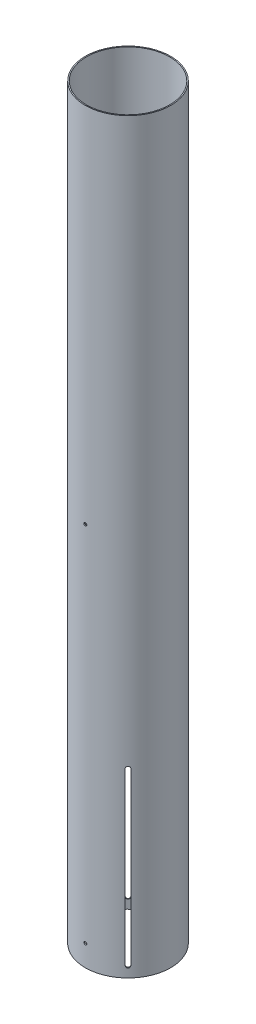
from build123d import *

# Parameters (mm, degrees)
SKETCH1_R           = 50.8
SKETCH1_R_2         = 49.53
BOSS_EXTRUDE1_DEPTH = 889
CUT_EXTRUDE1_DEPTH  = 152.4
CIRPATTERN1_COUNT   = 4
SKETCH3_R           = 1.7653
CUT_EXTRUDE2_DEPTH  = 11.684


with BuildPart() as part:
    # Sketch1 → Boss-Extrude1 (new body)
    with BuildSketch(Plane(origin=(0, 0, 0), x_dir=(1, 0, 0), z_dir=(0, 1, 0))):
        Circle(SKETCH1_R)
        Circle(SKETCH1_R_2, mode=Mode.SUBTRACT)
    extrude(amount=BOSS_EXTRUDE1_DEPTH)

    # Sketch2 → Cut-Extrude1 (cut)
    with BuildSketch(Plane(origin=(1.021732913, 1243.355570529, -179.1581259), x_dir=(0, 1, 0), z_dir=(0.7071067811865634, 0, -0.7071067811865316))):
        with BuildLine():
            Line((-1230.655570529, 128.342701458), (-1027.455570529, 128.342701458))
            ThreePointArc((-1027.455570529, 128.342701458), (-1025.074320529, 125.961451458), (-1027.455570529, 123.580201458))
            Line((-1027.455570529, 123.580201458), (-1230.655570529, 123.580201458))
            ThreePointArc((-1230.655570529, 123.580201458), (-1233.036820529, 125.961451458), (-1230.655570529, 128.342701458))
        make_face()
    cut_extrude1 = extrude(amount=-CUT_EXTRUDE1_DEPTH, mode=Mode.SUBTRACT)

    # CirPattern1: Cut-Extrude1 ×4 about axis
    cirpattern1_axis = Axis((0, 889, 0), (0, -1, 0))
    for i in range(1, CIRPATTERN1_COUNT):
        add(cut_extrude1.rotate(cirpattern1_axis, i * 360 / CIRPATTERN1_COUNT), mode=Mode.SUBTRACT)

    # Sketch3 → Cut-Extrude2 (cut)
    with BuildSketch(Plane(origin=(271.091614788, 1243.355570529, 52.3875), x_dir=(-1, 0, 0), z_dir=(0, 0, 1))):
        with Locations((271.091614788, 1217.955570529)):
            Circle(SKETCH3_R)
        with Locations((271.091614788, 786.155570529)):
            Circle(SKETCH3_R)
    extrude(amount=-CUT_EXTRUDE2_DEPTH, mode=Mode.SUBTRACT)


solid = part.part
